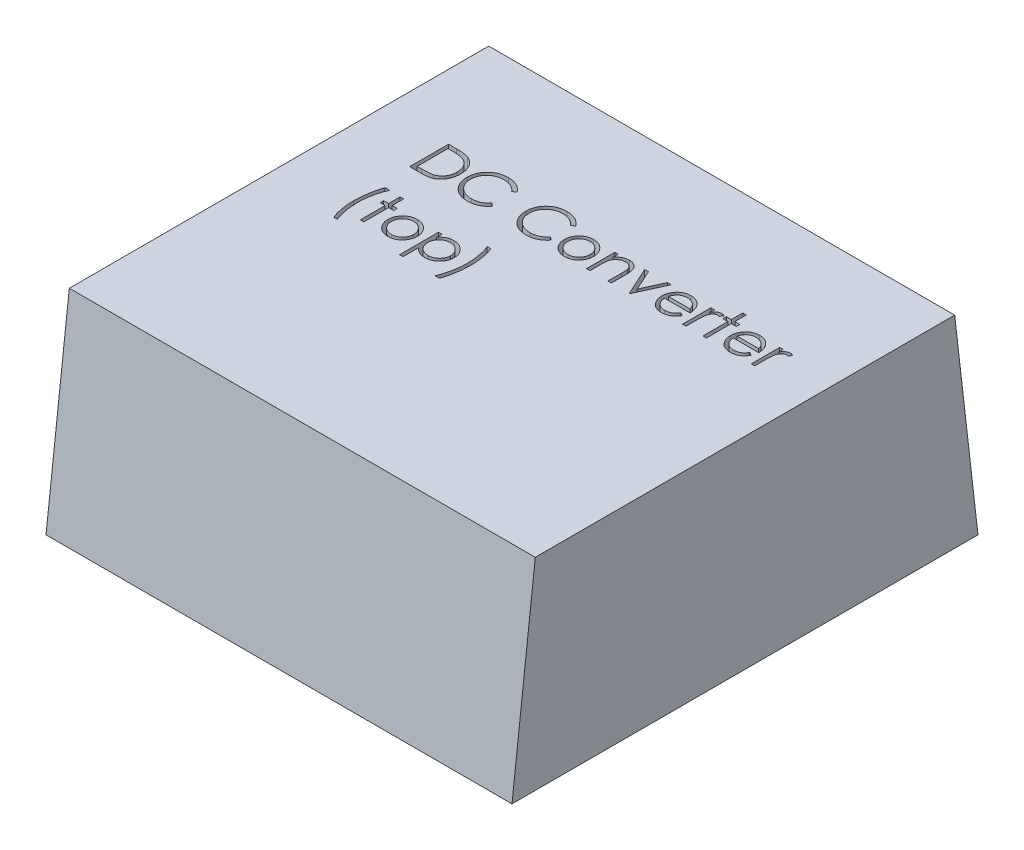
from build123d import *

# Parameters (mm, degrees)
BOSS_EXTRUDE1_DEPTH      = 38.1
BOSS_EXTRUDE1_DEPTH_BACK = 38.1
CUT_EXTRUDE1_DEPTH       = 7.62
SKETCH3_W                = 50.8
SKETCH3_H                = 17.78
BOSS_EXTRUDE2_DEPTH      = 6.35


with BuildPart() as part:
    # Sketch1 → Boss-Extrude1 (new, two sides: drawn at the far end of the back side and taken through both)
    with BuildSketch(Plane(origin=(0, 0, 0), x_dir=(0, 0, -1), z_dir=(1, 0, 0)).offset(-BOSS_EXTRUDE1_DEPTH_BACK)):
        Polygon((38.1, 0), (-38.1, 0), (-34.29, 33.02), (34.29, 33.02), align=None)
    extrude(amount=BOSS_EXTRUDE1_DEPTH + BOSS_EXTRUDE1_DEPTH_BACK)

    # Sketch2 → Cut-Extrude1 (cut)
    # profile 1 of 16: a face of its own
    with BuildSketch(Plane(origin=(0, 33.02, 0), x_dir=(1, 0, 0), z_dir=(0, 1, 0))):
        with BuildLine():
            Line((-27.488008029, 10.761967143), (-27.488008029, 17.111967143))
            Line((-27.488008029, 17.111967143), (-26.20579649, 17.111967143))
            add(Edge.make_bspline(
                [(-26.20579649, 17.111967143), (-26.094274183, 17.111164194), (-25.878813666, 17.109612902), (-25.567459654, 17.09977695), (-25.279380542, 17.082377104), (-25.015523784, 17.057032393), (-24.775165013, 17.025911889), (-24.558977253, 16.986904012), (-24.365842651, 16.940842618), (-24.24706238, 16.901571586), (-24.190892644, 16.883000797)],
                knots=[0, 0, 0, 0, 1.314313732, 2.53924729, 3.670748893, 4.714932338, 5.66265055, 6.526160246, 7.303039223, 8, 8, 8, 8], degree=3))
            add(Edge.make_bspline(
                [(-24.190892644, 16.883000797), (-24.117423617, 16.855005088), (-23.972151597, 16.79964852), (-23.765310103, 16.695224945), (-23.57059123, 16.576909746), (-23.386950781, 16.444546966), (-23.218583568, 16.294388791), (-23.058912098, 16.132813793), (-22.914468242, 15.953946376), (-22.782191762, 15.76149604), (-22.662928494, 15.557729889), (-22.559261736, 15.343036191), (-22.473166634, 15.118505257), (-22.401696066, 14.884761488), (-22.345368922, 14.641290917), (-22.306938845, 14.387810046), (-22.281591478, 14.125320659), (-22.279044128, 13.947204132), (-22.277751618, 13.856828922)],
                knots=[0, 0, 0, 0, 0.984719456, 1.947108742, 2.898477687, 3.838006223, 4.779231079, 5.722358779, 6.681677486, 7.655904652, 8.64651281, 9.637519902, 10.640069247, 11.656948941, 12.698408672, 13.768548281, 14.867775369, 16, 16, 16, 16], degree=3))
            add(Edge.make_bspline(
                [(-22.277751618, 13.856828922), (-22.278892745, 13.778340675), (-22.281141454, 13.623671386), (-22.301333213, 13.395722904), (-22.33068168, 13.174536853), (-22.37611901, 12.961166512), (-22.431277856, 12.753742459), (-22.501969959, 12.554475387), (-22.582951502, 12.361537333), (-22.677384853, 12.177537056), (-22.781055651, 12.003214366), (-22.892310814, 11.838884479), (-23.011031676, 11.686892291), (-23.138350324, 11.546777523), (-23.272621467, 11.418751403), (-23.414724181, 11.30174446), (-23.565025144, 11.198046139), (-23.72285117, 11.103581529), (-23.892806433, 11.021176027), (-24.078110076, 10.951453009), (-24.279552356, 10.89367415), (-24.496638821, 10.845466953), (-24.729744559, 10.807226704), (-24.979098111, 10.781597392), (-25.244316365, 10.764265643), (-25.426433032, 10.762748186), (-25.520169487, 10.761967143)],
                knots=[0, 0, 0, 0, 1.105936401, 2.179363191, 3.223086493, 4.248585256, 5.251745608, 6.245858792, 7.225916811, 8.198733463, 9.158002045, 10.082870192, 10.993790845, 11.873723703, 12.748670949, 13.606408763, 14.465103618, 15.319838547, 16.196477973, 17.123216899, 18.106603292, 19.147568657, 20.255746949, 21.433717677, 22.679120308, 24, 24, 24, 24], degree=3))
            Line((-25.520169487, 10.761967143), (-27.488008029, 10.761967143))
        make_face()
        with BuildLine():
            Line((-26.918136234, 11.413249194), (-26.189260032, 11.413249194))
            add(Edge.make_bspline(
                [(-26.189260032, 11.413249194), (-26.084524273, 11.413699312), (-25.883079053, 11.414565053), (-25.59341383, 11.422161836), (-25.328746925, 11.434575065), (-25.089040758, 11.451946992), (-24.874430671, 11.47493148), (-24.684468153, 11.500558089), (-24.519775899, 11.532484892), (-24.420118206, 11.56142449), (-24.374065721, 11.574797672)],
                knots=[0, 0, 0, 0, 1.375205317, 2.645023457, 3.804390687, 4.853969522, 5.800190428, 6.637939096, 7.370582563, 8, 8, 8, 8], degree=3))
            add(Edge.make_bspline(
                [(-24.374065721, 11.574797672), (-24.316102264, 11.595211213), (-24.201559806, 11.635550719), (-24.036675552, 11.709133904), (-23.882902129, 11.796295945), (-23.737559654, 11.893182928), (-23.602709865, 12.003212103), (-23.476754683, 12.123990897), (-23.3599477, 12.256133989), (-23.253495742, 12.399477367), (-23.158230676, 12.553128854), (-23.075732874, 12.715577881), (-23.003430809, 12.885044522), (-22.946682505, 13.064131138), (-22.902204231, 13.251236716), (-22.870699726, 13.446374417), (-22.851078726, 13.6495078), (-22.848790099, 13.787669511), (-22.847623413, 13.858100957)],
                knots=[0, 0, 0, 0, 0.998632004, 1.973411704, 2.929992603, 3.868527914, 4.809262121, 5.754881198, 6.702106254, 7.672490631, 8.653608572, 9.636854334, 10.631411391, 11.644891563, 12.686317036, 13.754757253, 14.855430412, 16, 16, 16, 16], degree=3))
            add(Edge.make_bspline(
                [(-22.847623413, 13.858100957), (-22.848554663, 13.932365985), (-22.850384112, 14.078260291), (-22.873378932, 14.292329124), (-22.906982326, 14.498215447), (-22.955575585, 14.69593303), (-23.017498751, 14.885867612), (-23.094777601, 15.066968723), (-23.183072753, 15.241148986), (-23.28812595, 15.404388192), (-23.403179955, 15.558771404), (-23.530865536, 15.700203894), (-23.669154091, 15.829007839), (-23.816537318, 15.947189163), (-23.977168913, 16.049993261), (-24.147264894, 16.141953382), (-24.329320612, 16.219996499), (-24.455980789, 16.261505293), (-24.520349775, 16.282600156)],
                knots=[0, 0, 0, 0, 1.122418816, 2.205001699, 3.251619955, 4.274784885, 5.280384055, 6.268708349, 7.249350384, 8.229342522, 9.199999885, 10.157847722, 11.105861043, 12.055065948, 13.010012805, 13.98527497, 14.976112212, 16, 16, 16, 16], degree=3))
            add(Edge.make_bspline(
                [(-24.520349775, 16.282600156), (-24.573601141, 16.297325675), (-24.686828155, 16.328636169), (-24.871594039, 16.362790773), (-25.079538668, 16.392916078), (-25.311585268, 16.418421378), (-25.56746933, 16.436722661), (-25.847387649, 16.450459189), (-26.151461218, 16.45972408), (-26.362249529, 16.460356734), (-26.471651859, 16.460685091)],
                knots=[0, 0, 0, 0, 0.674548936, 1.434276114, 2.292660221, 3.240891867, 4.284742987, 5.42552168, 6.663806718, 8, 8, 8, 8], degree=3))
            Line((-26.471651859, 16.460685091), (-26.918136234, 16.460685091))
            Line((-26.918136234, 16.460685091), (-26.918136234, 11.413249194))
        make_face(mode=Mode.SUBTRACT)
    # profile 2 of 16: a face of its own
    with BuildSketch(Plane(origin=(0, 33.02, 0), x_dir=(1, 0, 0), z_dir=(0, 1, 0))):
        with BuildLine():
            Line((-15.113649054, 15.946782848), (-15.612286875, 15.565172271))
            add(Edge.make_bspline(
                [(-15.612286875, 15.565172271), (-15.647857558, 15.607564816), (-15.718519354, 15.691778363), (-15.83220105, 15.81003268), (-15.950676888, 15.920822511), (-16.073901579, 16.024675636), (-16.204093125, 16.117960339), (-16.338097717, 16.205537912), (-16.478157027, 16.28403795), (-16.671835174, 16.379220797), (-16.925196271, 16.478545964), (-17.244138336, 16.56182754), (-17.5770799, 16.614843102), (-17.804224117, 16.620585029), (-17.91975883, 16.623505604)],
                knots=[0, 0, 0, 0, 0.757959112, 1.505699292, 2.245454638, 2.979532153, 3.711538275, 4.438200793, 5.171680507, 5.909471876, 7.393775596, 8.890124382, 10.418191784, 12, 12, 12, 12], degree=3))
            add(Edge.make_bspline(
                [(-17.91975883, 16.623505604), (-17.983409959, 16.622772701), (-18.110121474, 16.621313696), (-18.298169419, 16.602065712), (-18.482705954, 16.575012516), (-18.663611043, 16.534870859), (-18.840654411, 16.484120535), (-19.014993483, 16.423477284), (-19.184104142, 16.348447789), (-19.350325803, 16.265519946), (-19.509582372, 16.171853011), (-19.660267958, 16.069684501), (-19.801832986, 15.960157712), (-19.934389439, 15.842862133), (-20.058072831, 15.718326005), (-20.171986952, 15.585222128), (-20.275737625, 15.443976041), (-20.371381371, 15.296450288), (-20.457038758, 15.14307458), (-20.528757254, 14.983281238), (-20.592266547, 14.819806651), (-20.642520887, 14.650803831), (-20.682298225, 14.477461956), (-20.709744128, 14.299315812), (-20.728773212, 14.116737564), (-20.730224961, 13.992986383), (-20.730956747, 13.930606966)],
                knots=[0, 0, 0, 0, 1.054917814, 2.100044995, 3.131103042, 4.146048494, 5.169673617, 6.183595914, 7.203665975, 8.234915748, 9.262203917, 10.264457458, 11.251630812, 12.227803204, 13.197192746, 14.159520551, 15.12972552, 16.100847026, 17.073214652, 18.039054194, 19.002613845, 19.979014051, 20.95965708, 21.949030935, 22.966165397, 24, 24, 24, 24], degree=3))
            add(Edge.make_bspline(
                [(-20.730956747, 13.930606966), (-20.728667446, 13.836751572), (-20.724172709, 13.652478954), (-20.684170731, 13.38256656), (-20.623382923, 13.123993338), (-20.532277519, 12.878375624), (-20.41993867, 12.642684746), (-20.277987846, 12.42090854), (-20.113583557, 12.20969563), (-19.924399968, 12.014037711), (-19.71683513, 11.835305666), (-19.494135348, 11.677915326), (-19.256855283, 11.546715467), (-19.007614825, 11.437539107), (-18.744496018, 11.353616187), (-18.46797202, 11.294535563), (-18.178644257, 11.255996178), (-17.980942631, 11.252306487), (-17.880325737, 11.250428681)],
                knots=[0, 0, 0, 0, 1.029171465, 2.020641659, 2.987623507, 3.938342917, 4.889210282, 5.84687017, 6.821220943, 7.821438502, 8.827599549, 9.822697543, 10.807740252, 11.797342354, 12.80366471, 13.83203677, 14.896651826, 16, 16, 16, 16], degree=3))
            add(Edge.make_bspline(
                [(-17.880325737, 11.250428681), (-17.769468001, 11.25349261), (-17.551273458, 11.259523155), (-17.231291467, 11.310612079), (-16.92497515, 11.393448587), (-16.632308028, 11.509377674), (-16.35411517, 11.66008184), (-16.089961229, 11.84277656), (-15.839623237, 12.059199678), (-15.689089625, 12.224450497), (-15.612286875, 12.308762015)],
                knots=[0, 0, 0, 0, 1.028121516, 2.023589091, 2.998037872, 3.967518031, 4.937445131, 5.927275754, 6.942489185, 8, 8, 8, 8], degree=3))
            Line((-15.612286875, 12.308762015), (-15.113649054, 11.930967543))
            add(Edge.make_bspline(
                [(-15.113649054, 11.930967543), (-15.153777625, 11.879190638), (-15.233842553, 11.775884835), (-15.363487812, 11.630249019), (-15.500062338, 11.493263126), (-15.644580554, 11.366031584), (-15.795379976, 11.246008482), (-15.955168314, 11.136603731), (-16.121844988, 11.03629027), (-16.294845256, 10.944438564), (-16.473985311, 10.862945844), (-16.6590505, 10.793179723), (-16.849243116, 10.733081709), (-17.044571853, 10.68363891), (-17.245441868, 10.645047086), (-17.4511283, 10.619248533), (-17.662075074, 10.601573917), (-17.804390223, 10.599962984), (-17.876509631, 10.59914663)],
                knots=[0, 0, 0, 0, 0.986787822, 1.968848986, 2.935600012, 3.899624008, 4.868462664, 5.837806735, 6.815139263, 7.798259679, 8.787526145, 9.778297419, 10.776456485, 11.791383307, 12.812564526, 13.85620153, 14.913611965, 16, 16, 16, 16], degree=3))
            add(Edge.make_bspline(
                [(-17.876509631, 10.59914663), (-17.944805999, 10.599621959), (-18.079853608, 10.600561864), (-18.279241343, 10.615787654), (-18.473351011, 10.636560748), (-18.661627832, 10.667839271), (-18.845099244, 10.704749717), (-19.022102019, 10.754227568), (-19.1943779, 10.809652485), (-19.361234747, 10.874794389), (-19.522814488, 10.94830232), (-19.678595974, 11.031381291), (-19.828507559, 11.123332675), (-19.974023108, 11.222129622), (-20.11299301, 11.330945584), (-20.246621549, 11.448269335), (-20.375658041, 11.57370544), (-20.455491484, 11.664156389), (-20.495630224, 11.709633409)],
                knots=[0, 0, 0, 0, 1.114604814, 2.203992996, 3.262667896, 4.300477797, 5.318619304, 6.316056647, 7.298880507, 8.271930387, 9.238335007, 10.195173496, 11.151986948, 12.108099108, 13.064862484, 14.031167946, 15.010108607, 16, 16, 16, 16], degree=3))
            add(Edge.make_bspline(
                [(-20.495630224, 11.709633409), (-20.559920606, 11.788629566), (-20.6877252, 11.945668169), (-20.85123894, 12.200187021), (-20.991206647, 12.4659222), (-21.104374389, 12.744269785), (-21.192843919, 13.034605187), (-21.254132659, 13.337074763), (-21.293959141, 13.65139603), (-21.298513522, 13.865185632), (-21.300828541, 13.973856165)],
                knots=[0, 0, 0, 0, 0.994628077, 1.977248131, 2.950237994, 3.925870899, 4.908910175, 5.911660606, 6.938484602, 8, 8, 8, 8], degree=3))
            add(Edge.make_bspline(
                [(-21.300828541, 13.973856165), (-21.298006976, 14.088075345), (-21.292455722, 14.312794451), (-21.245291922, 14.642584338), (-21.169420677, 14.958544733), (-21.061657751, 15.260085812), (-20.925032328, 15.548793607), (-20.756255471, 15.82246265), (-20.557287942, 16.082843129), (-20.329690212, 16.325984178), (-20.080103761, 16.548305575), (-19.812825341, 16.74389683), (-19.528378094, 16.906670038), (-19.229895706, 17.042734504), (-18.915143113, 17.14731803), (-18.584791857, 17.22053024), (-18.239462683, 17.266099865), (-18.00385514, 17.271860599), (-17.884141843, 17.274787656)],
                knots=[0, 0, 0, 0, 1.032925535, 2.032216505, 3.007276963, 3.968222605, 4.92396291, 5.891752235, 6.871517503, 7.883894988, 8.900124299, 9.891468569, 10.874487609, 11.85992873, 12.854644235, 13.869047385, 14.917252991, 16, 16, 16, 16], degree=3))
            add(Edge.make_bspline(
                [(-17.884141843, 17.274787656), (-17.811181301, 17.273912919), (-17.666763256, 17.272181466), (-17.453126301, 17.255297466), (-17.245132365, 17.227151352), (-17.042638154, 17.188840768), (-16.844658551, 17.141293199), (-16.652706685, 17.079352943), (-16.46565621, 17.008529522), (-16.28468682, 16.92696202), (-16.110666793, 16.835400932), (-15.943650329, 16.734861158), (-15.784964086, 16.625467339), (-15.633491461, 16.508149864), (-15.491766335, 16.380426763), (-15.355764795, 16.245811125), (-15.230105411, 16.100425472), (-15.1525389, 15.998090807), (-15.113649054, 15.946782848)],
                knots=[0, 0, 0, 0, 1.096760587, 2.17092713, 3.219439832, 4.250915756, 5.268269357, 6.278326846, 7.281116186, 8.274029601, 9.260640565, 10.235837813, 11.203064059, 12.156899882, 13.114053108, 14.069676657, 15.032185724, 16, 16, 16, 16], degree=3))
        make_face()
    # profile 3 of 16: a face of its own
    with BuildSketch(Plane(origin=(0, 33.02, 0), x_dir=(1, 0, 0), z_dir=(0, 1, 0))):
        with BuildLine():
            Line((-5.507238798, 15.946782848), (-6.005876618, 15.565172271))
            add(Edge.make_bspline(
                [(-6.005876618, 15.565172271), (-6.041447301, 15.607564816), (-6.112109098, 15.691778363), (-6.225790794, 15.81003268), (-6.344266632, 15.920822511), (-6.467491323, 16.024675636), (-6.597682868, 16.117960339), (-6.73168746, 16.205537912), (-6.871746771, 16.28403795), (-7.065424918, 16.379220797), (-7.318786014, 16.478545964), (-7.637728079, 16.56182754), (-7.970669644, 16.614843102), (-8.19781386, 16.620585029), (-8.313348573, 16.623505604)],
                knots=[0, 0, 0, 0, 0.757959112, 1.505699292, 2.245454638, 2.979532153, 3.711538275, 4.438200793, 5.171680507, 5.909471876, 7.393775596, 8.890124382, 10.418191784, 12, 12, 12, 12], degree=3))
            add(Edge.make_bspline(
                [(-8.313348573, 16.623505604), (-8.376999702, 16.622772701), (-8.503711217, 16.621313696), (-8.691759162, 16.602065712), (-8.876295698, 16.575012516), (-9.057200786, 16.534870859), (-9.234244154, 16.484120535), (-9.408583226, 16.423477284), (-9.577693886, 16.348447789), (-9.743915547, 16.265519946), (-9.903172115, 16.171853011), (-10.053857702, 16.069684501), (-10.19542273, 15.960157712), (-10.327979183, 15.842862133), (-10.451662575, 15.718326005), (-10.565576696, 15.585222128), (-10.669327369, 15.443976041), (-10.764971114, 15.296450288), (-10.850628502, 15.14307458), (-10.922346997, 14.983281238), (-10.985856291, 14.819806651), (-11.036110631, 14.650803831), (-11.075887969, 14.477461956), (-11.103333872, 14.299315812), (-11.122362955, 14.116737564), (-11.123814705, 13.992986383), (-11.12454649, 13.930606966)],
                knots=[0, 0, 0, 0, 1.054917814, 2.100044995, 3.131103042, 4.146048494, 5.169673617, 6.183595914, 7.203665975, 8.234915748, 9.262203917, 10.264457458, 11.251630812, 12.227803204, 13.197192746, 14.159520551, 15.12972552, 16.100847026, 17.073214652, 18.039054194, 19.002613845, 19.979014051, 20.95965708, 21.949030935, 22.966165397, 24, 24, 24, 24], degree=3))
            add(Edge.make_bspline(
                [(-11.12454649, 13.930606966), (-11.12225719, 13.836751572), (-11.117762453, 13.652478954), (-11.077760475, 13.38256656), (-11.016972667, 13.123993338), (-10.925867263, 12.878375624), (-10.813528414, 12.642684746), (-10.67157759, 12.42090854), (-10.507173301, 12.20969563), (-10.317989711, 12.014037711), (-10.110424874, 11.835305666), (-9.887725091, 11.677915326), (-9.650445026, 11.546715467), (-9.401204569, 11.437539107), (-9.138085762, 11.353616187), (-8.861561763, 11.294535563), (-8.572234, 11.255996178), (-8.374532375, 11.252306487), (-8.27391548, 11.250428681)],
                knots=[0, 0, 0, 0, 1.029171465, 2.020641659, 2.987623507, 3.938342917, 4.889210282, 5.84687017, 6.821220943, 7.821438502, 8.827599549, 9.822697543, 10.807740252, 11.797342354, 12.80366471, 13.83203677, 14.896651826, 16, 16, 16, 16], degree=3))
            add(Edge.make_bspline(
                [(-8.27391548, 11.250428681), (-8.163057745, 11.25349261), (-7.944863201, 11.259523155), (-7.624881211, 11.310612079), (-7.318564893, 11.393448587), (-7.025897772, 11.509377674), (-6.747704914, 11.66008184), (-6.483550973, 11.84277656), (-6.233212981, 12.059199678), (-6.082679369, 12.224450497), (-6.005876618, 12.308762015)],
                knots=[0, 0, 0, 0, 1.028121516, 2.023589091, 2.998037872, 3.967518031, 4.937445131, 5.927275754, 6.942489185, 8, 8, 8, 8], degree=3))
            Line((-6.005876618, 12.308762015), (-5.507238798, 11.930967543))
            add(Edge.make_bspline(
                [(-5.507238798, 11.930967543), (-5.547367369, 11.879190638), (-5.627432297, 11.775884835), (-5.757077556, 11.630249019), (-5.893652081, 11.493263126), (-6.038170298, 11.366031584), (-6.18896972, 11.246008482), (-6.348758058, 11.136603731), (-6.515434731, 11.03629027), (-6.688435, 10.944438564), (-6.867575055, 10.862945844), (-7.052640244, 10.793179723), (-7.242832859, 10.733081709), (-7.438161596, 10.68363891), (-7.639031612, 10.645047086), (-7.844718044, 10.619248533), (-8.055664817, 10.601573917), (-8.197979967, 10.599962984), (-8.270099375, 10.59914663)],
                knots=[0, 0, 0, 0, 0.986787822, 1.968848986, 2.935600012, 3.899624008, 4.868462664, 5.837806735, 6.815139263, 7.798259679, 8.787526145, 9.778297419, 10.776456485, 11.791383307, 12.812564526, 13.85620153, 14.913611965, 16, 16, 16, 16], degree=3))
            add(Edge.make_bspline(
                [(-8.270099375, 10.59914663), (-8.338395742, 10.599621959), (-8.473443351, 10.600561864), (-8.672831086, 10.615787654), (-8.866940754, 10.636560748), (-9.055217576, 10.667839271), (-9.238688987, 10.704749717), (-9.415691762, 10.754227568), (-9.587967644, 10.809652485), (-9.754824491, 10.874794389), (-9.916404232, 10.94830232), (-10.072185718, 11.031381291), (-10.222097302, 11.123332675), (-10.367612852, 11.222129622), (-10.506582753, 11.330945584), (-10.640211292, 11.448269335), (-10.769247785, 11.57370544), (-10.849081228, 11.664156389), (-10.889219968, 11.709633409)],
                knots=[0, 0, 0, 0, 1.114604814, 2.203992996, 3.262667896, 4.300477797, 5.318619304, 6.316056647, 7.298880507, 8.271930387, 9.238335007, 10.195173496, 11.151986948, 12.108099108, 13.064862484, 14.031167946, 15.010108607, 16, 16, 16, 16], degree=3))
            add(Edge.make_bspline(
                [(-10.889219968, 11.709633409), (-10.953510349, 11.788629566), (-11.081314943, 11.945668169), (-11.244828683, 12.200187021), (-11.384796391, 12.4659222), (-11.497964133, 12.744269785), (-11.586433663, 13.034605187), (-11.647722402, 13.337074763), (-11.687548885, 13.65139603), (-11.692103266, 13.865185632), (-11.694418285, 13.973856165)],
                knots=[0, 0, 0, 0, 0.994628077, 1.977248131, 2.950237994, 3.925870899, 4.908910175, 5.911660606, 6.938484602, 8, 8, 8, 8], degree=3))
            add(Edge.make_bspline(
                [(-11.694418285, 13.973856165), (-11.69159672, 14.088075345), (-11.686045466, 14.312794451), (-11.638881665, 14.642584338), (-11.563010421, 14.958544733), (-11.455247494, 15.260085812), (-11.318622071, 15.548793607), (-11.149845215, 15.82246265), (-10.950877685, 16.082843129), (-10.723279955, 16.325984178), (-10.473693504, 16.548305575), (-10.206415085, 16.74389683), (-9.921967838, 16.906670038), (-9.62348545, 17.042734504), (-9.308732856, 17.14731803), (-8.978381601, 17.22053024), (-8.633052427, 17.266099865), (-8.397444883, 17.271860599), (-8.277731586, 17.274787656)],
                knots=[0, 0, 0, 0, 1.032925535, 2.032216505, 3.007276963, 3.968222605, 4.92396291, 5.891752235, 6.871517503, 7.883894988, 8.900124299, 9.891468569, 10.874487609, 11.85992873, 12.854644235, 13.869047385, 14.917252991, 16, 16, 16, 16], degree=3))
            add(Edge.make_bspline(
                [(-8.277731586, 17.274787656), (-8.204771044, 17.273912919), (-8.060352999, 17.272181466), (-7.846716044, 17.255297466), (-7.638722108, 17.227151352), (-7.436227898, 17.188840768), (-7.238248294, 17.141293199), (-7.046296429, 17.079352943), (-6.859245954, 17.008529522), (-6.678276563, 16.92696202), (-6.504256537, 16.835400932), (-6.337240073, 16.734861158), (-6.178553829, 16.625467339), (-6.027081204, 16.508149864), (-5.885356079, 16.380426763), (-5.749354539, 16.245811125), (-5.623695154, 16.100425472), (-5.546128643, 15.998090807), (-5.507238798, 15.946782848)],
                knots=[0, 0, 0, 0, 1.096760587, 2.17092713, 3.219439832, 4.250915756, 5.268269357, 6.278326846, 7.281116186, 8.274029601, 9.260640565, 10.235837813, 11.203064059, 12.156899882, 13.114053108, 14.069676657, 15.032185724, 16, 16, 16, 16], degree=3))
        make_face()
    # profile 4 of 16: a face of its own
    with BuildSketch(Plane(origin=(0, 33.02, 0), x_dir=(1, 0, 0), z_dir=(0, 1, 0))):
        with BuildLine():
            add(Edge.make_bspline(
                [(-2.126169086, 15.483762015), (-2.039099206, 15.481908012), (-1.868376448, 15.478272766), (-1.61835357, 15.4394199), (-1.379693109, 15.380006825), (-1.151481017, 15.297871276), (-0.936640024, 15.18777688), (-0.732040767, 15.056405738), (-0.538244194, 14.900771604), (-0.422088126, 14.780379108), (-0.363128221, 14.719268825)],
                knots=[0, 0, 0, 0, 1.054011418, 2.066658804, 3.057071809, 4.030435133, 4.997543892, 5.974964718, 6.972108034, 8, 8, 8, 8], degree=3))
            add(Edge.make_bspline(
                [(-0.363128221, 14.719268825), (-0.312360961, 14.660823451), (-0.211808929, 14.545063782), (-0.08287541, 14.357365741), (0.028197992, 14.162982987), (0.117212221, 13.959334266), (0.187397907, 13.748197363), (0.237228527, 13.528846571), (0.266868395, 13.301766312), (0.270865206, 13.147545063), (0.272889407, 13.069439098)],
                knots=[0, 0, 0, 0, 1.025258237, 2.030674902, 3.01204498, 3.988269485, 4.97094183, 5.956517959, 6.965070386, 8, 8, 8, 8], degree=3))
            add(Edge.make_bspline(
                [(0.272889407, 13.069439098), (0.271108981, 12.990880422), (0.267590776, 12.835644814), (0.234310215, 12.607009679), (0.182546673, 12.385313358), (0.108466052, 12.171484014), (0.013473483, 11.964868027), (-0.102442479, 11.766367844), (-0.24009527, 11.575591831), (-0.396131093, 11.394159925), (-0.568582354, 11.226944078), (-0.755664509, 11.081205646), (-0.953701113, 10.956343737), (-1.165325482, 10.855766241), (-1.388605066, 10.776464356), (-1.624021461, 10.720765754), (-1.871208945, 10.687089557), (-2.039986904, 10.682765074), (-2.126169086, 10.680556886)],
                knots=[0, 0, 0, 0, 0.998656419, 1.973391657, 2.932242238, 3.890759089, 4.846373663, 5.82037756, 6.809684879, 7.83454468, 8.860553229, 9.859544525, 10.845671541, 11.83227036, 12.833544569, 13.85385346, 14.904124723, 16, 16, 16, 16], degree=3))
            add(Edge.make_bspline(
                [(-2.126169086, 10.680556886), (-2.212773506, 10.682772485), (-2.382392637, 10.687111847), (-2.630452633, 10.720634918), (-2.866290942, 10.776438686), (-3.089862827, 10.856026851), (-3.30239705, 10.956346952), (-3.501581123, 11.08082816), (-3.688815255, 11.226987299), (-3.861302998, 11.394148214), (-4.01732904, 11.575594849), (-4.154984355, 11.766367061), (-4.270899661, 11.964868231), (-4.365892402, 12.171483959), (-4.439972977, 12.385313373), (-4.491736531, 12.607009675), (-4.525017089, 12.835644815), (-4.528535294, 12.990880422), (-4.530315721, 13.069439098)],
                knots=[0, 0, 0, 0, 1.099876186, 2.154163076, 3.173186993, 4.173200201, 5.163417411, 6.152872554, 7.150605724, 8.17532212, 9.198891216, 10.186952605, 11.159729845, 12.11414092, 13.071450619, 14.029093627, 15.002601286, 16, 16, 16, 16], degree=3))
            add(Edge.make_bspline(
                [(-4.530315721, 13.069439098), (-4.528277715, 13.147120545), (-4.524242813, 13.300916461), (-4.494632747, 13.527569843), (-4.444996509, 13.746549391), (-4.37472669, 13.956871326), (-4.284891986, 14.159627618), (-4.175379364, 14.354490668), (-4.045130645, 14.541339963), (-3.944978533, 14.656950023), (-3.894298093, 14.71545272)],
                knots=[0, 0, 0, 0, 1.031353054, 2.041901799, 3.029428768, 4.008703097, 4.981709435, 5.96992636, 6.972712378, 8, 8, 8, 8], degree=3))
            add(Edge.make_bspline(
                [(-3.894298093, 14.71545272), (-3.835427078, 14.777092967), (-3.719646867, 14.898319358), (-3.524885604, 15.053499795), (-3.320789672, 15.187604672), (-3.103574449, 15.29551152), (-2.875549835, 15.380489973), (-2.635666352, 15.439573122), (-2.38479506, 15.47813278), (-2.21323689, 15.481866903), (-2.126169086, 15.483762015)],
                knots=[0, 0, 0, 0, 1.027980169, 2.021703884, 2.998553061, 3.971491411, 4.943284454, 5.930300938, 6.949603206, 8, 8, 8, 8], degree=3))
        make_face()
        with BuildLine():
            add(Edge.make_bspline(
                [(-2.128713157, 14.91389022), (-2.19028568, 14.912140175), (-2.311841242, 14.908685262), (-2.490765346, 14.882407321), (-2.663013911, 14.840773992), (-2.828913728, 14.781620918), (-2.987905341, 14.705241488), (-3.140140971, 14.611427748), (-3.286068398, 14.501422242), (-3.422832998, 14.375397109), (-3.548349479, 14.237730933), (-3.658073808, 14.09104891), (-3.751373644, 13.937730254), (-3.829097932, 13.777615528), (-3.886986688, 13.609082148), (-3.929029171, 13.434038717), (-3.955282322, 13.252128604), (-3.958704752, 13.128465043), (-3.960443926, 13.065622992)],
                knots=[0, 0, 0, 0, 1.021534396, 2.016698045, 2.994645724, 3.958388632, 4.93408049, 5.916473867, 6.921342795, 7.962252576, 8.998418191, 10.008913653, 10.997312074, 11.973003931, 12.956656626, 13.948281152, 14.957379055, 16, 16, 16, 16], degree=3))
            add(Edge.make_bspline(
                [(-3.960443926, 13.065622992), (-3.957528689, 12.984430029), (-3.951742488, 12.823277179), (-3.904688559, 12.585948427), (-3.825973451, 12.358107067), (-3.719679387, 12.141088767), (-3.586499533, 11.940297634), (-3.429587283, 11.761279369), (-3.250626684, 11.606727969), (-3.051751034, 11.47849272), (-2.837022486, 11.376602878), (-2.609771732, 11.304396165), (-2.372752187, 11.257457523), (-2.210771432, 11.252792134), (-2.128713157, 11.250428681)],
                knots=[0, 0, 0, 0, 1.016792936, 2.018143844, 3.017858371, 4.030088057, 5.03801393, 6.028138512, 7.003788237, 7.991172063, 8.984598303, 9.972568034, 10.972917682, 12, 12, 12, 12], degree=3))
            add(Edge.make_bspline(
                [(-2.128713157, 11.250428681), (-2.046659602, 11.252805904), (-1.884688163, 11.257498476), (-1.647997942, 11.304159763), (-1.421368308, 11.376919262), (-1.20686279, 11.478378128), (-1.008077667, 11.607214938), (-0.827829976, 11.76040665), (-0.672257495, 11.940771781), (-0.539209384, 12.141354726), (-0.431174579, 12.357770622), (-0.352827913, 12.585990479), (-0.305660864, 12.823266469), (-0.299889932, 12.984426441), (-0.296982388, 13.065622992)],
                knots=[0, 0, 0, 0, 1.02726834, 2.027799167, 3.010890988, 4.004497153, 4.992059811, 5.971914811, 6.958719428, 7.966827853, 8.981595046, 9.981490638, 10.983022906, 12, 12, 12, 12], degree=3))
            add(Edge.make_bspline(
                [(-0.296982388, 13.065622992), (-0.298720963, 13.128465418), (-0.302142215, 13.252129719), (-0.328403936, 13.434034456), (-0.3704147, 13.609097782), (-0.428420349, 13.777557845), (-0.505806917, 13.938144817), (-0.600905956, 14.09059875), (-0.710182245, 14.238239055), (-0.837213307, 14.374952089), (-0.97383515, 14.50147137), (-1.119821719, 14.611470405), (-1.271831609, 14.704829185), (-1.430361323, 14.782274222), (-1.59628241, 14.840235825), (-1.76828963, 14.882647714), (-1.946450328, 14.908574213), (-2.067570306, 14.912106884), (-2.128713157, 14.91389022)],
                knots=[0, 0, 0, 0, 1.042956736, 2.052379634, 3.044323526, 4.02829302, 5.004299113, 5.996692471, 7.007513377, 8.048758398, 9.090003419, 10.095195979, 11.07790575, 12.047570684, 13.018257071, 13.989683339, 14.985167495, 16, 16, 16, 16], degree=3))
        make_face(mode=Mode.SUBTRACT)
    # profile 5 of 16: a face of its own
    with BuildSketch(Plane(origin=(0, 33.02, 0), x_dir=(1, 0, 0), z_dir=(0, 1, 0))):
        with BuildLine():
            Line((1.412632997, 15.402351758), (1.982504792, 15.402351758))
            Line((1.982504792, 15.402351758), (1.982504792, 14.565352559))
            add(Edge.make_bspline(
                [(1.982504792, 14.565352559), (2.043351644, 14.641267214), (2.161427084, 14.788582249), (2.358067232, 14.982203863), (2.565882594, 15.141761628), (2.783600514, 15.26894994), (3.011516547, 15.364828819), (3.248241408, 15.434072722), (3.495192375, 15.47559234), (3.66313071, 15.481017472), (3.748089728, 15.483762015)],
                knots=[0, 0, 0, 0, 1.12780773, 2.188550248, 3.19190651, 4.159438251, 5.104880172, 6.052711206, 7.014878035, 8, 8, 8, 8], degree=3))
            add(Edge.make_bspline(
                [(3.748089728, 15.483762015), (3.833961021, 15.480595731), (4.002031856, 15.474398551), (4.246739195, 15.425382555), (4.475290924, 15.341661878), (4.686872118, 15.226977121), (4.877602919, 15.08436252), (5.045106579, 14.918214258), (5.183651327, 14.727104507), (5.276537972, 14.549806781), (5.337725933, 14.39252854), (5.376247459, 14.257823722), (5.408960811, 14.107749362), (5.437321268, 13.942758965), (5.456511171, 13.761696534), (5.471646472, 13.565304293), (5.482493531, 13.353645856), (5.482923893, 13.20725726), (5.483145818, 13.131768825)],
                knots=[0, 0, 0, 0, 1.235846778, 2.418850247, 3.575807741, 4.728682307, 5.871620074, 6.994088408, 8.11269785, 9.256955736, 9.865816715, 10.540099792, 11.271859618, 12.076849838, 12.949306005, 13.892391288, 14.913166135, 16, 16, 16, 16], degree=3))
            Line((5.483145818, 13.131768825), (5.483145818, 10.761967143))
            Line((5.483145818, 10.761967143), (4.913274023, 10.761967143))
            Line((4.913274023, 10.761967143), (4.913274023, 12.944779643))
            add(Edge.make_bspline(
                [(4.913274023, 12.944779643), (4.912923488, 13.007957507), (4.912252975, 13.12880601), (4.910138159, 13.301832666), (4.905040367, 13.45874403), (4.897876999, 13.599164968), (4.887392187, 13.722960642), (4.876465413, 13.830383187), (4.863103241, 13.921296214), (4.851196241, 13.976024292), (4.845856154, 14.000568906)],
                knots=[0, 0, 0, 0, 1.430800155, 2.736877192, 3.918605307, 4.986035426, 5.920637409, 6.731861385, 7.431261377, 8, 8, 8, 8], degree=3))
            add(Edge.make_bspline(
                [(4.845856154, 14.000568906), (4.826578404, 14.072616341), (4.7894747, 14.211285364), (4.697791616, 14.39938026), (4.582014459, 14.559396973), (4.440685504, 14.690346168), (4.275169896, 14.792256114), (4.085926937, 14.862966003), (3.874782831, 14.90719152), (3.726275594, 14.911595031), (3.648870978, 14.91389022)],
                knots=[0, 0, 0, 0, 1.084156227, 2.086665306, 3.027808233, 3.945421172, 4.874247719, 5.839848303, 6.874090471, 8, 8, 8, 8], degree=3))
            add(Edge.make_bspline(
                [(3.648870978, 14.91389022), (3.60302818, 14.913026611), (3.512306469, 14.911317552), (3.377777234, 14.894170197), (3.247286234, 14.866124142), (3.119523855, 14.828262471), (2.997045429, 14.776260926), (2.87591593, 14.717243354), (2.760696515, 14.643677312), (2.648930351, 14.561688613), (2.544948543, 14.470830623), (2.448195701, 14.374955583), (2.36194815, 14.272855559), (2.283809267, 14.166175655), (2.216357275, 14.053450748), (2.157478101, 13.935768364), (2.107520483, 13.812973608), (2.08269617, 13.727747426), (2.070275225, 13.685104162)],
                knots=[0, 0, 0, 0, 1.023777757, 2.026029729, 3.023749952, 4.003683103, 4.997618607, 5.993177895, 7.010360494, 8.046726602, 9.087585522, 10.09234134, 11.086953743, 12.070360549, 13.043493632, 14.017870808, 15.008233677, 16, 16, 16, 16], degree=3))
            add(Edge.make_bspline(
                [(2.070275225, 13.685104162), (2.063127577, 13.653798294), (2.04756752, 13.585647056), (2.030761466, 13.473806466), (2.015507722, 13.344429797), (2.002740668, 13.197668022), (1.994929413, 13.033007306), (1.986412436, 12.851150857), (1.98331171, 12.651373528), (1.982781297, 12.512287314), (1.982504792, 12.439781646)],
                knots=[0, 0, 0, 0, 0.615963638, 1.340920617, 2.168419149, 3.115676021, 4.16674242, 5.331190069, 6.6087489, 8, 8, 8, 8], degree=3))
            Line((1.982504792, 12.439781646), (1.982504792, 10.761967143))
            Line((1.982504792, 10.761967143), (1.412632997, 10.761967143))
            Line((1.412632997, 10.761967143), (1.412632997, 15.402351758))
        make_face()
    # profile 6 of 16: a face of its own
    with BuildSketch(Plane(origin=(0, 33.02, 0), x_dir=(1, 0, 0), z_dir=(0, 1, 0))):
        Polygon((6.297248382, 15.402351758), (6.914185481, 15.402351758), (8.454620177, 12.023826117), (9.995054872, 15.402351758), (10.611991971, 15.402351758), (8.495325305, 10.761967143), (8.413915048, 10.761967143), align=None)
    # profile 7 of 16: a face of its own
    with BuildSketch(Plane(origin=(0, 33.02, 0), x_dir=(1, 0, 0), z_dir=(0, 1, 0))):
        with BuildLine():
            Line((15.397388606, 12.227351758), (15.903658638, 11.96149639))
            add(Edge.make_bspline(
                [(15.903658638, 11.96149639), (15.863315101, 11.889934917), (15.784822554, 11.750704631), (15.64983834, 11.559421112), (15.508338437, 11.387340256), (15.353935524, 11.239059312), (15.191249106, 11.109788942), (15.019377004, 10.996690317), (14.837424435, 10.900318145), (14.645382791, 10.819124273), (14.44163932, 10.756695619), (14.225700283, 10.712600818), (13.997151998, 10.685344317), (13.840495358, 10.682178133), (13.760279231, 10.680556886)],
                knots=[0, 0, 0, 0, 1.120438281, 2.179929193, 3.190490725, 4.156257408, 5.095198341, 6.022838206, 6.959905092, 7.901321166, 8.864066838, 9.862729781, 10.905609505, 12, 12, 12, 12], degree=3))
            add(Edge.make_bspline(
                [(13.760279231, 10.680556886), (13.671121643, 10.68263819), (13.497201019, 10.686698211), (13.244036049, 10.721700254), (13.005676247, 10.778800104), (12.782135014, 10.858566158), (12.573959784, 10.962755732), (12.380736804, 11.08968222), (12.20144995, 11.238693597), (12.041748885, 11.411080573), (11.897977841, 11.595560695), (11.771112425, 11.787794943), (11.665053942, 11.98729965), (11.578779921, 12.192804744), (11.509102523, 12.403014951), (11.460540075, 12.619842899), (11.432546104, 12.842701745), (11.428256324, 12.993464054), (11.426094536, 13.069439098)],
                knots=[0, 0, 0, 0, 1.145258523, 2.234067595, 3.276747158, 4.290159414, 5.277019952, 6.260822364, 7.254936242, 8.264827045, 9.274100331, 10.257902744, 11.220704747, 12.172965371, 13.118907548, 14.062713208, 15.023725156, 16, 16, 16, 16], degree=3))
            add(Edge.make_bspline(
                [(11.426094536, 13.069439098), (11.428016121, 13.140731147), (11.431824448, 13.282022575), (11.455828877, 13.491147205), (11.49837078, 13.694398827), (11.556747825, 13.891946325), (11.632133657, 14.083458939), (11.724357826, 14.269053226), (11.833563997, 14.448531694), (11.917878706, 14.561748808), (11.960349343, 14.61877804)],
                knots=[0, 0, 0, 0, 1.024358464, 2.0301432, 3.019427413, 4.004406732, 4.986367066, 5.972626655, 6.978780325, 8, 8, 8, 8], degree=3))
            add(Edge.make_bspline(
                [(11.960349343, 14.61877804), (12.017876139, 14.68748299), (12.131107428, 14.822716492), (12.322616816, 15.000404597), (12.529990029, 15.149255446), (12.750628265, 15.272639822), (12.987095868, 15.366390581), (13.236214153, 15.436254338), (13.500819717, 15.475403015), (13.681713474, 15.480932656), (13.774271619, 15.483762015)],
                knots=[0, 0, 0, 0, 1.030682036, 2.02871468, 2.997146059, 3.962720338, 4.930598197, 5.918074684, 6.934738563, 8, 8, 8, 8], degree=3))
            add(Edge.make_bspline(
                [(13.774271619, 15.483762015), (13.86942656, 15.481305383), (14.056098863, 15.476486032), (14.328299997, 15.431806827), (14.585857297, 15.360954335), (14.828667698, 15.260889601), (15.056755817, 15.131785843), (15.268639078, 14.971871359), (15.467941108, 14.786055686), (15.58388953, 14.643156721), (15.642891411, 14.5704407)],
                knots=[0, 0, 0, 0, 1.056321875, 2.072262726, 3.055038591, 4.01806755, 4.982017516, 5.957941055, 6.960871419, 8, 8, 8, 8], degree=3))
            add(Edge.make_bspline(
                [(15.642891411, 14.5704407), (15.683035999, 14.515642774), (15.76305796, 14.406411673), (15.863291985, 14.228301145), (15.950300401, 14.041954781), (16.019847345, 13.844360385), (16.076161868, 13.637859147), (16.116904954, 13.420974816), (16.140798405, 13.193771976), (16.145495041, 13.038965226), (16.147889407, 12.960044066)],
                knots=[0, 0, 0, 0, 0.94817472, 1.890038105, 2.849395472, 3.817997239, 4.812318967, 5.836947057, 6.897266129, 8, 8, 8, 8], degree=3))
            Line((16.147889407, 12.960044066), (11.99596633, 12.960044066))
            add(Edge.make_bspline(
                [(11.99596633, 12.960044066), (11.998759616, 12.898901795), (12.004252501, 12.778667985), (12.029861403, 12.602735279), (12.070227036, 12.435143644), (12.126958049, 12.277150125), (12.195659326, 12.126691179), (12.279816269, 11.984882912), (12.380218031, 11.852371239), (12.492206086, 11.727970861), (12.616860387, 11.617189194), (12.748001943, 11.518035257), (12.887508839, 11.434930817), (13.034281077, 11.367475875), (13.188081315, 11.314668701), (13.348958012, 11.278622798), (13.516594595, 11.254479904), (13.630868712, 11.251795369), (13.689045257, 11.250428681)],
                knots=[0, 0, 0, 0, 1.094153842, 2.151609401, 3.174256925, 4.172055639, 5.149267565, 6.128595816, 7.11444997, 8.118368179, 9.117203808, 10.09244225, 11.054858984, 12.015122123, 12.976791628, 13.957293641, 14.960065497, 16, 16, 16, 16], degree=3))
            add(Edge.make_bspline(
                [(13.689045257, 11.250428681), (13.745925196, 11.25153187), (13.858785907, 11.253720807), (14.026862891, 11.275005846), (14.192216033, 11.309423346), (14.35416096, 11.356395185), (14.509410923, 11.413684617), (14.653184993, 11.482814087), (14.785410527, 11.55928577), (14.908994166, 11.646751895), (15.028865825, 11.753809606), (15.147778622, 11.887405842), (15.275280551, 12.0454075), (15.35509024, 12.164326065), (15.397388606, 12.227351758)],
                knots=[0, 0, 0, 0, 0.99110716, 1.966546729, 2.947904876, 3.932708344, 4.903319531, 5.828989031, 6.710028674, 7.56322171, 8.463672341, 9.504779593, 10.677557249, 12, 12, 12, 12], degree=3))
        make_face()
        with BuildLine():
            add(Edge.make_bspline(
                [(15.578017612, 13.529915861), (15.557159451, 13.605504217), (15.517014204, 13.750987472), (15.433128228, 13.952447373), (15.338655576, 14.131495422), (15.226856149, 14.286761328), (15.100185032, 14.424653416), (14.95387163, 14.545155706), (14.78979508, 14.652955938), (14.608803496, 14.743946902), (14.417139115, 14.821398503), (14.216467881, 14.873332641), (14.011711608, 14.908909954), (13.873219403, 14.912223036), (13.80352843, 14.91389022)],
                knots=[0, 0, 0, 0, 1.154881502, 2.222775134, 3.210006277, 4.132804581, 5.035138423, 5.962687519, 6.919655026, 7.923214229, 8.944639381, 9.960483929, 10.97369054, 12, 12, 12, 12], degree=3))
            add(Edge.make_bspline(
                [(13.80352843, 14.91389022), (13.746651591, 14.912780473), (13.634218039, 14.910586736), (13.468571816, 14.889776645), (13.309495791, 14.855378069), (13.155816197, 14.808270219), (13.009546908, 14.745480326), (12.867679257, 14.671850758), (12.733820538, 14.58196817), (12.650107045, 14.513462819), (12.607815289, 14.478854162)],
                knots=[0, 0, 0, 0, 1.04873581, 2.073130211, 3.073294108, 4.04793562, 5.032784715, 6.005352987, 6.992311501, 8, 8, 8, 8], degree=3))
            add(Edge.make_bspline(
                [(12.607815289, 14.478854162), (12.577528906, 14.451468761), (12.516236648, 14.396047383), (12.434338845, 14.300562965), (12.355924558, 14.197599417), (12.284562074, 14.083217548), (12.219107024, 13.958719849), (12.15785678, 13.825156425), (12.102727147, 13.681513746), (12.071709919, 13.581415178), (12.055751987, 13.529915861)],
                knots=[0, 0, 0, 0, 0.879870761, 1.780643979, 2.707998968, 3.669668524, 4.684282772, 5.740141944, 6.837334558, 8, 8, 8, 8], degree=3))
            Line((12.055751987, 13.529915861), (15.578017612, 13.529915861))
        make_face(mode=Mode.SUBTRACT)
    # profile 8 of 16: a face of its own
    with BuildSketch(Plane(origin=(0, 33.02, 0), x_dir=(1, 0, 0), z_dir=(0, 1, 0))):
        with BuildLine():
            Line((17.124812484, 15.402351758), (17.694684279, 15.402351758))
            Line((17.694684279, 15.402351758), (17.694684279, 14.719268825))
            add(Edge.make_bspline(
                [(17.694684279, 14.719268825), (17.736755313, 14.782870114), (17.817215838, 14.904507084), (17.950952153, 15.06537853), (18.087936768, 15.1985744), (18.228825465, 15.304716499), (18.374654303, 15.384206014), (18.522222773, 15.442431949), (18.673852554, 15.476862221), (18.775746331, 15.481459003), (18.826795657, 15.483762015)],
                knots=[0, 0, 0, 0, 1.2804753, 2.448899062, 3.506932113, 4.484331642, 5.4025378, 6.288909075, 7.142734305, 8, 8, 8, 8], degree=3))
            add(Edge.make_bspline(
                [(18.826795657, 15.483762015), (18.86639485, 15.481602059), (18.947872761, 15.477157811), (19.071212603, 15.445932457), (19.198291437, 15.396079473), (19.280192625, 15.349197927), (19.322889407, 15.324757607)],
                knots=[0, 0, 0, 0, 0.901110191, 1.854092781, 2.881294221, 4, 4, 4, 4], degree=3))
            Line((19.322889407, 15.324757607), (19.009968734, 14.831207928))
            add(Edge.make_bspline(
                [(19.009968734, 14.831207928), (18.982556653, 14.843436697), (18.930523275, 14.86664924), (18.854405705, 14.894121173), (18.784226708, 14.910297192), (18.739516252, 14.912747779), (18.718672661, 14.91389022)],
                knots=[0, 0, 0, 0, 1.180555205, 2.24091978, 3.179933427, 4, 4, 4, 4], degree=3))
            add(Edge.make_bspline(
                [(18.718672661, 14.91389022), (18.672942258, 14.910842152), (18.579665494, 14.904624977), (18.442715045, 14.855750283), (18.309823686, 14.776783062), (18.20428367, 14.689205473), (18.122564154, 14.604754469), (18.064252602, 14.531006653), (18.010762476, 14.448313993), (17.959653647, 14.358090138), (17.913087656, 14.25879456), (17.869627042, 14.151419302), (17.830331677, 14.035839997), (17.807924805, 13.955317424), (17.7964471, 13.914070508)],
                knots=[0, 0, 0, 0, 1.125678352, 2.296057538, 3.5422874, 4.923748041, 5.663163013, 6.437101912, 7.23742474, 8.08941207, 8.991984279, 9.93940061, 10.944477711, 12, 12, 12, 12], degree=3))
            add(Edge.make_bspline(
                [(17.7964471, 13.914070508), (17.787861186, 13.877281922), (17.76884404, 13.795797999), (17.750353678, 13.659094247), (17.732084695, 13.497579894), (17.719209402, 13.310805361), (17.707274954, 13.09923707), (17.700543805, 12.862552712), (17.694913822, 12.600509346), (17.694763115, 12.41731302), (17.694684279, 12.321482367)],
                knots=[0, 0, 0, 0, 0.566838948, 1.255505196, 2.06880316, 3.007127437, 4.065329342, 5.249902469, 6.561414163, 8, 8, 8, 8], degree=3))
            Line((17.694684279, 12.321482367), (17.694684279, 10.761967143))
            Line((17.694684279, 10.761967143), (17.124812484, 10.761967143))
            Line((17.124812484, 10.761967143), (17.124812484, 15.402351758))
        make_face()
    # profile 9 of 16: a face of its own
    with BuildSketch(Plane(origin=(0, 33.02, 0), x_dir=(1, 0, 0), z_dir=(0, 1, 0))):
        Polygon((20.462632997, 17.274787656), (21.032504792, 17.274787656), (21.032504792, 15.402351758), (21.846607356, 15.402351758), (21.846607356, 14.832479963), (21.032504792, 14.832479963), (21.032504792, 10.761967143), (20.462632997, 10.761967143), (20.462632997, 14.832479963), (19.648530433, 14.832479963), (19.648530433, 15.402351758), (20.462632997, 15.402351758), align=None)
    # profile 10 of 16: a face of its own
    with BuildSketch(Plane(origin=(0, 33.02, 0), x_dir=(1, 0, 0), z_dir=(0, 1, 0))):
        with BuildLine():
            Line((26.632003991, 12.227351758), (27.138274023, 11.96149639))
            add(Edge.make_bspline(
                [(27.138274023, 11.96149639), (27.097930486, 11.889934917), (27.019437939, 11.750704631), (26.884453725, 11.559421112), (26.742953822, 11.387340256), (26.588550908, 11.239059312), (26.425864491, 11.109788942), (26.253992389, 10.996690317), (26.072039819, 10.900318145), (25.879998176, 10.819124273), (25.676254704, 10.756695619), (25.460315667, 10.712600818), (25.231767383, 10.685344317), (25.075110742, 10.682178133), (24.994894616, 10.680556886)],
                knots=[0, 0, 0, 0, 1.120438281, 2.179929193, 3.190490725, 4.156257408, 5.095198341, 6.022838206, 6.959905092, 7.901321166, 8.864066838, 9.862729781, 10.905609505, 12, 12, 12, 12], degree=3))
            add(Edge.make_bspline(
                [(24.994894616, 10.680556886), (24.905737028, 10.68263819), (24.731816403, 10.686698211), (24.478651433, 10.721700254), (24.240291631, 10.778800104), (24.016750398, 10.858566158), (23.808575169, 10.962755732), (23.615352189, 11.08968222), (23.436065335, 11.238693597), (23.27636427, 11.411080573), (23.132593225, 11.595560695), (23.005727809, 11.787794943), (22.899669327, 11.98729965), (22.813395306, 12.192804744), (22.743717908, 12.403014951), (22.69515546, 12.619842899), (22.667161488, 12.842701745), (22.662871709, 12.993464054), (22.66070992, 13.069439098)],
                knots=[0, 0, 0, 0, 1.145258523, 2.234067595, 3.276747158, 4.290159414, 5.277019952, 6.260822364, 7.254936242, 8.264827045, 9.274100331, 10.257902744, 11.220704747, 12.172965371, 13.118907548, 14.062713208, 15.023725156, 16, 16, 16, 16], degree=3))
            add(Edge.make_bspline(
                [(22.66070992, 13.069439098), (22.662631505, 13.140731147), (22.666439833, 13.282022575), (22.690444261, 13.491147205), (22.732986165, 13.694398827), (22.791363209, 13.891946325), (22.866749042, 14.083458939), (22.958973211, 14.269053226), (23.068179382, 14.448531694), (23.15249409, 14.561748808), (23.194964728, 14.61877804)],
                knots=[0, 0, 0, 0, 1.024358464, 2.0301432, 3.019427413, 4.004406732, 4.986367066, 5.972626655, 6.978780325, 8, 8, 8, 8], degree=3))
            add(Edge.make_bspline(
                [(23.194964728, 14.61877804), (23.252491524, 14.68748299), (23.365722813, 14.822716492), (23.5572322, 15.000404597), (23.764605414, 15.149255446), (23.985243649, 15.272639822), (24.221711252, 15.366390581), (24.470829538, 15.436254338), (24.735435101, 15.475403015), (24.916328859, 15.480932656), (25.008887003, 15.483762015)],
                knots=[0, 0, 0, 0, 1.030682036, 2.02871468, 2.997146059, 3.962720338, 4.930598197, 5.918074684, 6.934738563, 8, 8, 8, 8], degree=3))
            add(Edge.make_bspline(
                [(25.008887003, 15.483762015), (25.104041945, 15.481305383), (25.290714248, 15.476486032), (25.562915382, 15.431806827), (25.820472682, 15.360954335), (26.063283082, 15.260889601), (26.291371201, 15.131785843), (26.503254463, 14.971871359), (26.702556493, 14.786055686), (26.818504914, 14.643156721), (26.877506795, 14.5704407)],
                knots=[0, 0, 0, 0, 1.056321875, 2.072262726, 3.055038591, 4.01806755, 4.982017516, 5.957941055, 6.960871419, 8, 8, 8, 8], degree=3))
            add(Edge.make_bspline(
                [(26.877506795, 14.5704407), (26.917651383, 14.515642774), (26.997673345, 14.406411673), (27.097907369, 14.228301145), (27.184915786, 14.041954781), (27.25446273, 13.844360385), (27.310777253, 13.637859147), (27.351520339, 13.420974816), (27.375413789, 13.193771976), (27.380110426, 13.038965226), (27.382504792, 12.960044066)],
                knots=[0, 0, 0, 0, 0.94817472, 1.890038105, 2.849395472, 3.817997239, 4.812318967, 5.836947057, 6.897266129, 8, 8, 8, 8], degree=3))
            Line((27.382504792, 12.960044066), (23.230581715, 12.960044066))
            add(Edge.make_bspline(
                [(23.230581715, 12.960044066), (23.233375001, 12.898901795), (23.238867885, 12.778667985), (23.264476788, 12.602735279), (23.30484242, 12.435143644), (23.361573434, 12.277150125), (23.43027471, 12.126691179), (23.514431653, 11.984882912), (23.614833416, 11.852371239), (23.72682147, 11.727970861), (23.851475772, 11.617189194), (23.982617327, 11.518035257), (24.122124224, 11.434930817), (24.268896461, 11.367475875), (24.4226967, 11.314668701), (24.583573397, 11.278622798), (24.751209979, 11.254479904), (24.865484097, 11.251795369), (24.923660641, 11.250428681)],
                knots=[0, 0, 0, 0, 1.094153842, 2.151609401, 3.174256925, 4.172055639, 5.149267565, 6.128595816, 7.11444997, 8.118368179, 9.117203808, 10.09244225, 11.054858984, 12.015122123, 12.976791628, 13.957293641, 14.960065497, 16, 16, 16, 16], degree=3))
            add(Edge.make_bspline(
                [(24.923660641, 11.250428681), (24.980540581, 11.25153187), (25.093401291, 11.253720807), (25.261478275, 11.275005846), (25.426831418, 11.309423346), (25.588776345, 11.356395185), (25.744026308, 11.413684617), (25.887800377, 11.482814087), (26.020025911, 11.55928577), (26.143609551, 11.646751895), (26.26348121, 11.753809606), (26.382394007, 11.887405842), (26.509895935, 12.0454075), (26.589705625, 12.164326065), (26.632003991, 12.227351758)],
                knots=[0, 0, 0, 0, 0.99110716, 1.966546729, 2.947904876, 3.932708344, 4.903319531, 5.828989031, 6.710028674, 7.56322171, 8.463672341, 9.504779593, 10.677557249, 12, 12, 12, 12], degree=3))
        make_face()
        with BuildLine():
            add(Edge.make_bspline(
                [(26.812632997, 13.529915861), (26.791774835, 13.605504217), (26.751629588, 13.750987472), (26.667743613, 13.952447373), (26.57327096, 14.131495422), (26.461471534, 14.286761328), (26.334800417, 14.424653416), (26.188487014, 14.545155706), (26.024410465, 14.652955938), (25.843418881, 14.743946902), (25.651754499, 14.821398503), (25.451083265, 14.873332641), (25.246326993, 14.908909954), (25.107834788, 14.912223036), (25.038143814, 14.91389022)],
                knots=[0, 0, 0, 0, 1.154881502, 2.222775134, 3.210006277, 4.132804581, 5.035138423, 5.962687519, 6.919655026, 7.923214229, 8.944639381, 9.960483929, 10.97369054, 12, 12, 12, 12], degree=3))
            add(Edge.make_bspline(
                [(25.038143814, 14.91389022), (24.981266976, 14.912780473), (24.868833424, 14.910586736), (24.7031872, 14.889776645), (24.544111175, 14.855378069), (24.390431582, 14.808270219), (24.244162292, 14.745480326), (24.102294641, 14.671850758), (23.968435922, 14.58196817), (23.884722429, 14.513462819), (23.842430673, 14.478854162)],
                knots=[0, 0, 0, 0, 1.04873581, 2.073130211, 3.073294108, 4.04793562, 5.032784715, 6.005352987, 6.992311501, 8, 8, 8, 8], degree=3))
            add(Edge.make_bspline(
                [(23.842430673, 14.478854162), (23.81214429, 14.451468761), (23.750852033, 14.396047383), (23.668954229, 14.300562965), (23.590539943, 14.197599417), (23.519177459, 14.083217548), (23.453722409, 13.958719849), (23.392472165, 13.825156425), (23.337342531, 13.681513746), (23.306325303, 13.581415178), (23.290367372, 13.529915861)],
                knots=[0, 0, 0, 0, 0.879870761, 1.780643979, 2.707998968, 3.669668524, 4.684282772, 5.740141944, 6.837334558, 8, 8, 8, 8], degree=3))
            Line((23.290367372, 13.529915861), (26.812632997, 13.529915861))
        make_face(mode=Mode.SUBTRACT)
    # profile 11 of 16: a face of its own
    with BuildSketch(Plane(origin=(0, 33.02, 0), x_dir=(1, 0, 0), z_dir=(0, 1, 0))):
        with BuildLine():
            Line((28.359427869, 15.402351758), (28.929299664, 15.402351758))
            Line((28.929299664, 15.402351758), (28.929299664, 14.719268825))
            add(Edge.make_bspline(
                [(28.929299664, 14.719268825), (28.971370697, 14.782870114), (29.051831223, 14.904507084), (29.185567537, 15.06537853), (29.322552153, 15.1985744), (29.46344085, 15.304716499), (29.609269688, 15.384206014), (29.756838158, 15.442431949), (29.908467939, 15.476862221), (30.010361715, 15.481459003), (30.061411042, 15.483762015)],
                knots=[0, 0, 0, 0, 1.2804753, 2.448899062, 3.506932113, 4.484331642, 5.4025378, 6.288909075, 7.142734305, 8, 8, 8, 8], degree=3))
            add(Edge.make_bspline(
                [(30.061411042, 15.483762015), (30.101010234, 15.481602059), (30.182488146, 15.477157811), (30.305827988, 15.445932457), (30.432906822, 15.396079473), (30.51480801, 15.349197927), (30.557504792, 15.324757607)],
                knots=[0, 0, 0, 0, 0.901110191, 1.854092781, 2.881294221, 4, 4, 4, 4], degree=3))
            Line((30.557504792, 15.324757607), (30.244584119, 14.831207928))
            add(Edge.make_bspline(
                [(30.244584119, 14.831207928), (30.217172038, 14.843436697), (30.16513866, 14.86664924), (30.08902109, 14.894121173), (30.018842093, 14.910297192), (29.974131637, 14.912747779), (29.953288045, 14.91389022)],
                knots=[0, 0, 0, 0, 1.180555205, 2.24091978, 3.179933427, 4, 4, 4, 4], degree=3))
            add(Edge.make_bspline(
                [(29.953288045, 14.91389022), (29.907557643, 14.910842152), (29.814280878, 14.904624977), (29.677330429, 14.855750283), (29.544439071, 14.776783062), (29.438899055, 14.689205473), (29.357179539, 14.604754469), (29.298867987, 14.531006653), (29.24537786, 14.448313993), (29.194269032, 14.358090138), (29.147703041, 14.25879456), (29.104242427, 14.151419302), (29.064947061, 14.035839997), (29.04254019, 13.955317424), (29.031062484, 13.914070508)],
                knots=[0, 0, 0, 0, 1.125678352, 2.296057538, 3.5422874, 4.923748041, 5.663163013, 6.437101912, 7.23742474, 8.08941207, 8.991984279, 9.93940061, 10.944477711, 12, 12, 12, 12], degree=3))
            add(Edge.make_bspline(
                [(29.031062484, 13.914070508), (29.022476571, 13.877281922), (29.003459424, 13.795797999), (28.984969063, 13.659094247), (28.96670008, 13.497579894), (28.953824787, 13.310805361), (28.941890339, 13.09923707), (28.93515919, 12.862552712), (28.929529206, 12.600509346), (28.929378499, 12.41731302), (28.929299664, 12.321482367)],
                knots=[0, 0, 0, 0, 0.566838948, 1.255505196, 2.06880316, 3.007127437, 4.065329342, 5.249902469, 6.561414163, 8, 8, 8, 8], degree=3))
            Line((28.929299664, 12.321482367), (28.929299664, 10.761967143))
            Line((28.929299664, 10.761967143), (28.359427869, 10.761967143))
            Line((28.359427869, 10.761967143), (28.359427869, 15.402351758))
        make_face()
    # profile 12 of 16: a face of its own
    with BuildSketch(Plane(origin=(0, 33.02, 0), x_dir=(1, 0, 0), z_dir=(0, 1, 0))):
        with BuildLine():
            Line((-26.511084952, 5.772864579), (-25.778392644, 5.772864579))
            add(Edge.make_bspline(
                [(-25.778392644, 5.772864579), (-25.812045243, 5.700187888), (-25.880376421, 5.552618784), (-25.973234379, 5.323815219), (-26.063271219, 5.087180149), (-26.144823727, 4.840327768), (-26.225975826, 4.585695053), (-26.298811937, 4.321022202), (-26.368004694, 4.04800441), (-26.452602025, 3.671514781), (-26.542007754, 3.190542592), (-26.618039824, 2.603302147), (-26.665195011, 2.007146695), (-26.670992227, 1.606187093), (-26.673905464, 1.404695508)],
                knots=[0, 0, 0, 0, 0.641680859, 1.302924882, 1.97816193, 2.670100703, 3.385789831, 4.119463781, 4.869353995, 5.64252846, 7.211246119, 8.787408069, 10.385597356, 12, 12, 12, 12], degree=3))
            add(Edge.make_bspline(
                [(-26.673905464, 1.404695508), (-26.671251793, 1.218503281), (-26.665981962, 0.848750887), (-26.630207257, 0.299386904), (-26.568879246, -0.240055363), (-26.484357175, -0.765538395), (-26.378850821, -1.270471611), (-26.252395318, -1.746998661), (-26.111100084, -2.193532682), (-25.996840087, -2.475242676), (-25.941213157, -2.612391832)],
                knots=[0, 0, 0, 0, 1.087438645, 2.159504985, 3.213761363, 4.257235816, 5.266994431, 6.225081839, 7.135889631, 8, 8, 8, 8], degree=3))
            Line((-25.941213157, -2.612391832), (-26.511084952, -2.612391832))
            add(Edge.make_bspline(
                [(-26.511084952, -2.612391832), (-26.538600911, -2.547674296), (-26.594371707, -2.416501383), (-26.672148682, -2.213907155), (-26.744303508, -2.002363095), (-26.812807669, -1.782585796), (-26.87774061, -1.554411051), (-26.938920627, -1.318285798), (-26.994518371, -1.073369674), (-27.064704839, -0.735077284), (-27.136277703, -0.300306849), (-27.198674784, 0.231498795), (-27.236236821, 0.774070175), (-27.241249945, 1.13920588), (-27.243777259, 1.323285252)],
                knots=[0, 0, 0, 0, 0.628236805, 1.273343465, 1.938200331, 2.624718736, 3.329767296, 4.057431036, 4.803593529, 5.573251756, 7.143838059, 8.738091941, 10.355542947, 12, 12, 12, 12], degree=3))
            add(Edge.make_bspline(
                [(-27.243777259, 1.323285252), (-27.24169989, 1.52220089), (-27.237563939, 1.918233228), (-27.200574991, 2.507653812), (-27.142214596, 3.089421257), (-27.06155686, 3.660771386), (-26.957680045, 4.218082165), (-26.831900918, 4.756338618), (-26.685446658, 5.274173906), (-26.568715, 5.608037289), (-26.511084952, 5.772864579)],
                knots=[0, 0, 0, 0, 1.053308321, 2.097090816, 3.12621109, 4.149053282, 5.151853223, 6.127344058, 7.075475725, 8, 8, 8, 8], degree=3))
        make_face()
    # profile 13 of 16: a face of its own
    with BuildSketch(Plane(origin=(0, 33.02, 0), x_dir=(1, 0, 0), z_dir=(0, 1, 0))):
        Polygon((-23.987367003, 5.691454322), (-23.417495208, 5.691454322), (-23.417495208, 3.819018425), (-22.603392644, 3.819018425), (-22.603392644, 3.24914663), (-23.417495208, 3.24914663), (-23.417495208, -0.821366191), (-23.987367003, -0.821366191), (-23.987367003, 3.24914663), (-24.801469567, 3.24914663), (-24.801469567, 3.819018425), (-23.987367003, 3.819018425), align=None)
    # profile 14 of 16: a face of its own
    with BuildSketch(Plane(origin=(0, 33.02, 0), x_dir=(1, 0, 0), z_dir=(0, 1, 0))):
        with BuildLine():
            add(Edge.make_bspline(
                [(-19.385143445, 3.900428681), (-19.298073565, 3.898574679), (-19.127350807, 3.894939433), (-18.877327929, 3.856086567), (-18.638667468, 3.796673491), (-18.410455376, 3.714537943), (-18.195614383, 3.604443547), (-17.991015126, 3.473072404), (-17.797218553, 3.31743827), (-17.681062485, 3.197045775), (-17.62210258, 3.135935492)],
                knots=[0, 0, 0, 0, 1.054011418, 2.066658804, 3.057071809, 4.030435133, 4.997543892, 5.974964718, 6.972108034, 8, 8, 8, 8], degree=3))
            add(Edge.make_bspline(
                [(-17.62210258, 3.135935492), (-17.57133532, 3.077490118), (-17.470783288, 2.961730448), (-17.341849769, 2.774032408), (-17.230776367, 2.579649654), (-17.141762138, 2.376000933), (-17.071576452, 2.164864029), (-17.021745832, 1.945513238), (-16.992105964, 1.718432979), (-16.988109153, 1.56421173), (-16.986084952, 1.486105765)],
                knots=[0, 0, 0, 0, 1.025258237, 2.030674902, 3.01204498, 3.988269485, 4.97094183, 5.956517959, 6.965070386, 8, 8, 8, 8], degree=3))
            add(Edge.make_bspline(
                [(-16.986084952, 1.486105765), (-16.987865378, 1.407547088), (-16.991383583, 1.252311481), (-17.024664144, 1.023676346), (-17.076427686, 0.801980025), (-17.150508307, 0.58815068), (-17.245500876, 0.381534693), (-17.361416838, 0.183034511), (-17.499069629, -0.007741502), (-17.655105452, -0.189173409), (-17.827556713, -0.356389256), (-18.014638868, -0.502127687), (-18.212675472, -0.626989596), (-18.424299841, -0.727567093), (-18.647579424, -0.806868978), (-18.882995819, -0.862567579), (-19.130183304, -0.896243777), (-19.298961263, -0.90056826), (-19.385143445, -0.902776447)],
                knots=[0, 0, 0, 0, 0.998656419, 1.973391657, 2.932242238, 3.890759089, 4.846373663, 5.82037756, 6.809684879, 7.83454468, 8.860553229, 9.859544525, 10.845671541, 11.83227036, 12.833544569, 13.85385346, 14.904124723, 16, 16, 16, 16], degree=3))
            add(Edge.make_bspline(
                [(-19.385143445, -0.902776447), (-19.471747865, -0.900560848), (-19.641366996, -0.896221486), (-19.889426992, -0.862698416), (-20.125265301, -0.806894647), (-20.348837186, -0.727306482), (-20.561371409, -0.626986381), (-20.760555482, -0.502505173), (-20.947789614, -0.356346034), (-21.120277357, -0.18918512), (-21.276303398, -0.007738485), (-21.413958714, 0.183033728), (-21.52987402, 0.381534897), (-21.624866761, 0.588150626), (-21.698947336, 0.801980039), (-21.75071089, 1.023676342), (-21.783991448, 1.252311482), (-21.787509653, 1.407547089), (-21.78929008, 1.486105765)],
                knots=[0, 0, 0, 0, 1.099876186, 2.154163076, 3.173186993, 4.173200201, 5.163417411, 6.152872554, 7.150605724, 8.17532212, 9.198891216, 10.186952605, 11.159729845, 12.11414092, 13.071450619, 14.029093627, 15.002601286, 16, 16, 16, 16], degree=3))
            add(Edge.make_bspline(
                [(-21.78929008, 1.486105765), (-21.787252074, 1.563787212), (-21.783217172, 1.717583128), (-21.753607106, 1.944236509), (-21.703970868, 2.163216058), (-21.633701049, 2.373537993), (-21.543866345, 2.576294284), (-21.434353723, 2.771157335), (-21.304105004, 2.95800663), (-21.203952892, 3.073616689), (-21.153272452, 3.132119386)],
                knots=[0, 0, 0, 0, 1.031353054, 2.041901799, 3.029428768, 4.008703097, 4.981709435, 5.96992636, 6.972712378, 8, 8, 8, 8], degree=3))
            add(Edge.make_bspline(
                [(-21.153272452, 3.132119386), (-21.094401437, 3.193759633), (-20.978621226, 3.314986025), (-20.783859963, 3.470166462), (-20.579764031, 3.604271338), (-20.362548807, 3.712178186), (-20.134524194, 3.79715664), (-19.894640711, 3.856239789), (-19.643769419, 3.894799447), (-19.472211249, 3.89853357), (-19.385143445, 3.900428681)],
                knots=[0, 0, 0, 0, 1.027980169, 2.021703884, 2.998553061, 3.971491411, 4.943284454, 5.930300938, 6.949603206, 8, 8, 8, 8], degree=3))
        make_face()
        with BuildLine():
            add(Edge.make_bspline(
                [(-19.387687516, 3.330556886), (-19.449260039, 3.328806841), (-19.570815601, 3.325351929), (-19.749739705, 3.299073987), (-19.92198827, 3.257440659), (-20.087888087, 3.198287585), (-20.2468797, 3.121908154), (-20.39911533, 3.028094415), (-20.545042757, 2.918088908), (-20.681807357, 2.792063775), (-20.807323838, 2.6543976), (-20.917048167, 2.507715577), (-21.010348003, 2.35439692), (-21.088072291, 2.194282194), (-21.145961047, 2.025748815), (-21.18800353, 1.850705384), (-21.214256681, 1.668795271), (-21.217679111, 1.545131709), (-21.219418285, 1.482289659)],
                knots=[0, 0, 0, 0, 1.021534396, 2.016698045, 2.994645724, 3.958388632, 4.93408049, 5.916473867, 6.921342795, 7.962252576, 8.998418191, 10.008913653, 10.997312074, 11.973003931, 12.956656626, 13.948281152, 14.957379055, 16, 16, 16, 16], degree=3))
            add(Edge.make_bspline(
                [(-21.219418285, 1.482289659), (-21.216503048, 1.401096695), (-21.210716847, 1.239943845), (-21.163662918, 1.002615094), (-21.08494781, 0.774773734), (-20.978653746, 0.557755433), (-20.845473892, 0.3569643), (-20.688561642, 0.177946036), (-20.509601043, 0.023394635), (-20.310725393, -0.104840613), (-20.095996845, -0.206730456), (-19.868746091, -0.278937169), (-19.631726546, -0.325875811), (-19.469745791, -0.3305412), (-19.387687516, -0.332904652)],
                knots=[0, 0, 0, 0, 1.016792936, 2.018143844, 3.017858371, 4.030088057, 5.03801393, 6.028138512, 7.003788237, 7.991172063, 8.984598303, 9.972568034, 10.972917682, 12, 12, 12, 12], degree=3))
            add(Edge.make_bspline(
                [(-19.387687516, -0.332904652), (-19.305633961, -0.330527429), (-19.143662522, -0.325834858), (-18.906972301, -0.27917357), (-18.680342667, -0.206414072), (-18.465837149, -0.104955205), (-18.267052026, 0.023881604), (-18.086804335, 0.177073317), (-17.931231854, 0.357438447), (-17.798183743, 0.558021393), (-17.690148938, 0.774437289), (-17.611802272, 1.002657145), (-17.564635223, 1.239933136), (-17.558864291, 1.401093107), (-17.555956747, 1.482289659)],
                knots=[0, 0, 0, 0, 1.02726834, 2.027799167, 3.010890988, 4.004497153, 4.992059811, 5.971914811, 6.958719428, 7.966827853, 8.981595046, 9.981490638, 10.983022906, 12, 12, 12, 12], degree=3))
            add(Edge.make_bspline(
                [(-17.555956747, 1.482289659), (-17.557695322, 1.545132085), (-17.561116574, 1.668796386), (-17.587378295, 1.850701123), (-17.629389059, 2.025764448), (-17.687394708, 2.194224511), (-17.764781276, 2.354811484), (-17.859880315, 2.507265417), (-17.969156604, 2.654905722), (-18.096187666, 2.791618756), (-18.232809509, 2.918138037), (-18.378796078, 3.028137072), (-18.530805968, 3.121495852), (-18.689335682, 3.198940888), (-18.855256769, 3.256902492), (-19.027263989, 3.29931438), (-19.205424687, 3.32524088), (-19.326544665, 3.328773551), (-19.387687516, 3.330556886)],
                knots=[0, 0, 0, 0, 1.042956736, 2.052379634, 3.044323526, 4.02829302, 5.004299113, 5.996692471, 7.007513377, 8.048758398, 9.090003419, 10.095195979, 11.07790575, 12.047570684, 13.018257071, 13.989683339, 14.985167495, 16, 16, 16, 16], degree=3))
        make_face(mode=Mode.SUBTRACT)
    # profile 15 of 16: a face of its own
    with BuildSketch(Plane(origin=(0, 33.02, 0), x_dir=(1, 0, 0), z_dir=(0, 1, 0))):
        with BuildLine():
            Line((-15.846341362, 3.819018425), (-15.276469567, 3.819018425))
            Line((-15.276469567, 3.819018425), (-15.276469567, 2.960394627))
            add(Edge.make_bspline(
                [(-15.276469567, 2.960394627), (-15.21594956, 3.038295944), (-15.098341038, 3.189681564), (-14.89564014, 3.385606511), (-14.681687215, 3.550843134), (-14.450976452, 3.680351444), (-14.207093472, 3.777997774), (-13.951039124, 3.850169061), (-13.680640222, 3.892698594), (-13.495770944, 3.897817893), (-13.401489599, 3.900428681)],
                knots=[0, 0, 0, 0, 1.0828784, 2.104357462, 3.088488658, 4.04616522, 5.001424249, 5.969181776, 6.964304535, 8, 8, 8, 8], degree=3))
            add(Edge.make_bspline(
                [(-13.401489599, 3.900428681), (-13.319136262, 3.898046199), (-13.156360565, 3.893337099), (-12.916760135, 3.861454557), (-12.686027653, 3.806812458), (-12.46546847, 3.728070798), (-12.252719766, 3.630724445), (-12.050931099, 3.507866395), (-11.856959362, 3.365615163), (-11.675682848, 3.201908261), (-11.50818551, 3.024782692), (-11.363321724, 2.834242225), (-11.238368412, 2.636552962), (-11.137366588, 2.428650166), (-11.058248586, 2.212170992), (-11.0019791, 1.98624082), (-10.968491661, 1.751697328), (-10.96399867, 1.592216678), (-10.961725977, 1.51154647)],
                knots=[0, 0, 0, 0, 1.041296284, 2.058176809, 3.050446431, 4.034000596, 5.01514041, 6.003636468, 7.015969324, 8.052561599, 9.08815499, 10.094063707, 11.074456064, 12.040834395, 13.011057502, 13.983766392, 14.980127149, 16, 16, 16, 16], degree=3))
            add(Edge.make_bspline(
                [(-10.961725977, 1.51154647), (-10.963949358, 1.42917371), (-10.968334186, 1.26672274), (-11.002342983, 1.028167578), (-11.056693312, 0.798683343), (-11.134813158, 0.578651736), (-11.235762716, 0.368224254), (-11.358598132, 0.16755265), (-11.503535008, -0.023298783), (-11.66918134, -0.201739044), (-11.848891667, -0.366112083), (-12.040983683, -0.509872581), (-12.242476306, -0.630597648), (-12.452338666, -0.731441017), (-12.672367324, -0.807445408), (-12.9015357, -0.862269132), (-13.139719023, -0.896077432), (-13.301736827, -0.900526319), (-13.383681105, -0.902776447)],
                knots=[0, 0, 0, 0, 1.038740735, 2.04854663, 3.033179607, 4.009277356, 4.987731542, 5.972001279, 6.972200261, 8.005528982, 9.039189865, 10.040446548, 11.026516639, 11.997840187, 12.972163198, 13.956796175, 14.96660207, 16, 16, 16, 16], degree=3))
            add(Edge.make_bspline(
                [(-13.383681105, -0.902776447), (-13.475896843, -0.900427296), (-13.658049961, -0.895787034), (-13.924382877, -0.848761818), (-14.180699451, -0.778481949), (-14.424159947, -0.675613775), (-14.656692979, -0.544521625), (-14.876983198, -0.384664537), (-15.086200735, -0.196376832), (-15.212128052, -0.053534823), (-15.276469567, 0.019449114)],
                knots=[0, 0, 0, 0, 1.014726462, 2.004382257, 2.969841629, 3.936926163, 4.907207904, 5.903978561, 6.929055279, 8, 8, 8, 8], degree=3))
            Line((-15.276469567, 0.019449114), (-15.276469567, -2.530981575))
            Line((-15.276469567, -2.530981575), (-15.846341362, -2.530981575))
            Line((-15.846341362, -2.530981575), (-15.846341362, 3.819018425))
        make_face()
        with BuildLine():
            add(Edge.make_bspline(
                [(-13.40657774, 3.330556886), (-13.471129232, 3.329395275), (-13.598214481, 3.327108362), (-13.784491221, 3.29994134), (-13.963915783, 3.260502867), (-14.134679895, 3.200791277), (-14.298420299, 3.127496287), (-14.453875855, 3.035907495), (-14.600937442, 2.927681713), (-14.739235054, 2.804892046), (-14.864172744, 2.669592255), (-14.974776913, 2.52519723), (-15.067681595, 2.371889834), (-15.144792404, 2.211098105), (-15.203472359, 2.041561659), (-15.245120594, 1.86424605), (-15.271301377, 1.6789572), (-15.274728449, 1.552762731), (-15.276469567, 1.488649835)],
                knots=[0, 0, 0, 0, 1.05670511, 2.080379991, 3.077984906, 4.06214886, 5.038337365, 6.01289324, 7.01187578, 8.025460281, 9.038092164, 10.024533457, 11.000252242, 11.969694649, 12.940728589, 13.933144304, 14.949937299, 16, 16, 16, 16], degree=3))
            add(Edge.make_bspline(
                [(-15.276469567, 1.488649835), (-15.2735833, 1.404488545), (-15.267928857, 1.23960945), (-15.221959632, 0.998701115), (-15.147147082, 0.770733111), (-15.040959273, 0.55762523), (-14.906797245, 0.361713515), (-14.745147733, 0.186289129), (-14.55747339, 0.032454771), (-14.346894342, -0.09712379), (-14.121157048, -0.20233071), (-13.885688322, -0.277649349), (-13.643726324, -0.324044677), (-13.48013523, -0.329935335), (-13.397673493, -0.332904652)],
                knots=[0, 0, 0, 0, 1.03728447, 2.032128127, 3.01272805, 3.987917167, 4.958271349, 5.931593992, 6.91984656, 7.941419022, 8.973179163, 9.983609215, 10.983593296, 12, 12, 12, 12], degree=3))
            add(Edge.make_bspline(
                [(-13.397673493, -0.332904652), (-13.316872886, -0.33008094), (-13.156498206, -0.324476378), (-12.920354185, -0.275965667), (-12.690864027, -0.201861122), (-12.472822857, -0.09380307), (-12.268128815, 0.03862175), (-12.083286568, 0.197480667), (-11.921802596, 0.381612421), (-11.78416298, 0.586642134), (-11.673253, 0.806488901), (-11.589922422, 1.033966563), (-11.541828296, 1.268273259), (-11.535012408, 1.426111967), (-11.531597772, 1.505186293)],
                knots=[0, 0, 0, 0, 1.00104056, 1.986885549, 2.97790532, 3.984399681, 4.995088187, 5.994304198, 6.996462723, 8.023150851, 9.048424203, 10.043036403, 11.019596776, 12, 12, 12, 12], degree=3))
            add(Edge.make_bspline(
                [(-11.531597772, 1.505186293), (-11.534237075, 1.584751774), (-11.539495118, 1.743262839), (-11.591287601, 1.976875534), (-11.669120417, 2.205272291), (-11.782620411, 2.422116717), (-11.917242715, 2.626721124), (-12.080069409, 2.807340304), (-12.262615937, 2.965492811), (-12.467066277, 3.09614934), (-12.686486763, 3.200081595), (-12.917472397, 3.276070483), (-13.158851504, 3.321742857), (-13.323275963, 3.327593033), (-13.40657774, 3.330556886)],
                knots=[0, 0, 0, 0, 0.983928682, 1.960191568, 2.949917689, 3.96440592, 4.982380491, 5.975291189, 6.965713506, 7.964880129, 8.970154049, 9.96478489, 10.968906225, 12, 12, 12, 12], degree=3))
        make_face(mode=Mode.SUBTRACT)
    # profile 16 of 16: a face of its own
    with BuildSketch(Plane(origin=(0, 33.02, 0), x_dir=(1, 0, 0), z_dir=(0, 1, 0))):
        with BuildLine():
            Line((-9.252110593, -2.612391832), (-9.9848029, -2.612391832))
            add(Edge.make_bspline(
                [(-9.9848029, -2.612391832), (-9.950611046, -2.539766627), (-9.881262209, -2.392466234), (-9.788972216, -2.163061737), (-9.697469263, -1.92671553), (-9.613852086, -1.680348639), (-9.535539889, -1.42526079), (-9.4608412, -1.161344206), (-9.394789186, -0.888056216), (-9.308714109, -0.51204425), (-9.21953449, -0.030998707), (-9.145660465, 0.556860383), (-9.097879561, 1.153312052), (-9.092162857, 1.554280971), (-9.08929008, 1.755777239)],
                knots=[0, 0, 0, 0, 0.643010096, 1.304170363, 1.980525948, 2.673468857, 3.388058623, 4.118367826, 4.870637152, 5.640399836, 7.208918794, 8.78781499, 10.385801844, 12, 12, 12, 12], degree=3))
            add(Edge.make_bspline(
                [(-9.08929008, 1.755777239), (-9.091958254, 1.942390421), (-9.097244858, 2.312137745), (-9.132693909, 2.862020229), (-9.195836039, 3.400873784), (-9.279978418, 3.92647046), (-9.386321046, 4.431070995), (-9.509944724, 4.908247118), (-9.652475613, 5.354313037), (-9.766430331, 5.635693667), (-9.821982388, 5.772864579)],
                knots=[0, 0, 0, 0, 1.089953881, 2.159587681, 3.216624426, 4.25769169, 5.267486842, 6.22737404, 7.135858364, 8, 8, 8, 8], degree=3))
            Line((-9.821982388, 5.772864579), (-9.252110593, 5.772864579))
            add(Edge.make_bspline(
                [(-9.252110593, 5.772864579), (-9.224063736, 5.708191617), (-9.167284188, 5.577264237), (-9.089793948, 5.373792805), (-9.016839368, 5.162273865), (-8.945872827, 4.942561878), (-8.881606708, 4.714136936), (-8.822008124, 4.476887889), (-8.765670469, 4.231477504), (-8.69837035, 3.891413083), (-8.625048044, 3.456686437), (-8.564908886, 2.924203971), (-8.526874671, 2.381752023), (-8.521915504, 2.016183594), (-8.519418285, 1.832099354)],
                knots=[0, 0, 0, 0, 0.628844065, 1.27306534, 1.941820192, 2.624928913, 3.332648663, 4.058377701, 4.807203874, 5.57876041, 7.15092291, 8.738794632, 10.357799901, 12, 12, 12, 12], degree=3))
            add(Edge.make_bspline(
                [(-8.519418285, 1.832099354), (-8.521454734, 1.633604079), (-8.525500498, 1.239258365), (-8.563024706, 0.651161419), (-8.620329902, 0.070481995), (-8.703372166, -0.500607861), (-8.807090114, -1.057427982), (-8.930928939, -1.596052866), (-9.077842902, -2.11367851), (-9.194511619, -2.447557056), (-9.252110593, -2.612391832)],
                knots=[0, 0, 0, 0, 1.05226665, 2.090512442, 3.123047645, 4.145154173, 5.149102219, 6.125200057, 7.074417238, 8, 8, 8, 8], degree=3))
        make_face()
    extrude(amount=-CUT_EXTRUDE1_DEPTH, mode=Mode.SUBTRACT)

    # Sketch3 → Boss-Extrude2 (add)
    with BuildSketch(Plane.ZY.offset(38.1)):
        with Locations((0, 8.89)):
            Rectangle(SKETCH3_W, SKETCH3_H)
    extrude(amount=BOSS_EXTRUDE2_DEPTH)


solid = part.part
